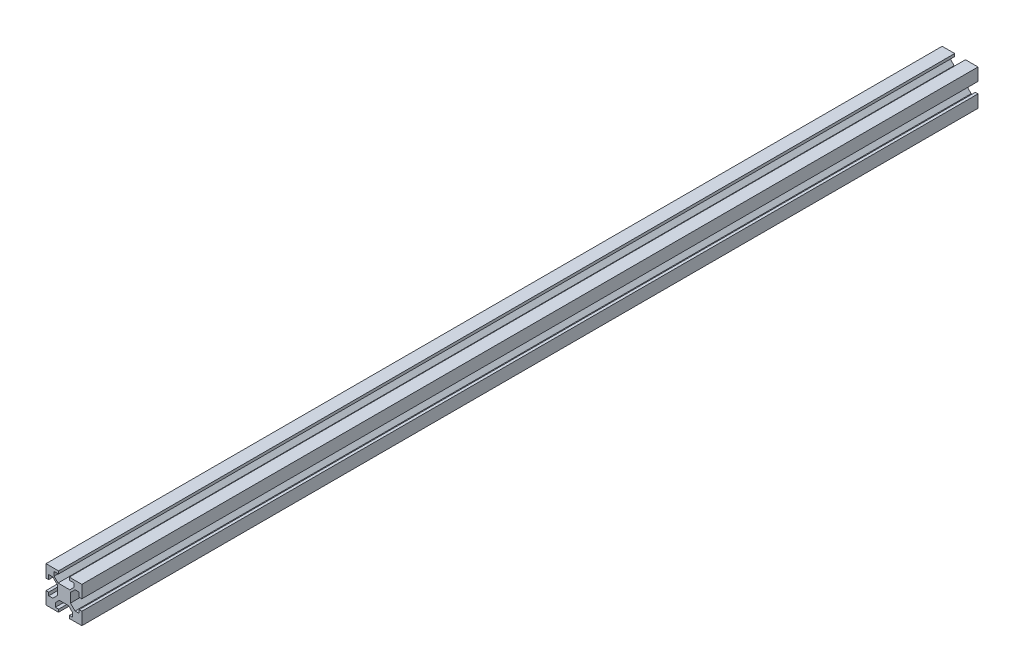
from build123d import *

# Parameters (mm, degrees)
BOSS_EXTRUDE1_DEPTH = 500


with BuildPart() as part:
    # Sketch1 → Boss-Extrude1 (new body)
    with BuildSketch(Plane.XY):
        Polygon((-10, 3), (-10, 10), (-3, 10), (-3, 8.5), (-5.5, 8.5), (-5.5, 6.207106781), (-3.292893219, 4), (3.292893219, 4), (5.5, 6.207106781), (5.5, 8.5), (3, 8.5), (3, 10), (10, 10), (10, 3), (8.5, 3), (8.5, 5.5), (6.207106781, 5.5), (3.645660172, 2.938553391), (3.645660172, -2.231446609), (6.207106781, -4.792893219), (8.5, -4.792893219), (8.5, -3), (10, -3), (10, -10), (3, -10), (3, -8.5), (4.792893219, -8.5), (4.792893219, -6.207106781), (2.585786438, -4), (-2.585786438, -4), (-4.792893219, -6.207106781), (-4.792893219, -8.5), (-3, -8.5), (-3, -10), (-10, -10), (-10, -3), (-8.5, -3), (-8.5, -4.792893219), (-6.207106781, -4.792893219), (-3.645660172, -2.231446609), (-3.645660172, 2.938553391), (-6.207106781, 5.5), (-8.5, 5.5), (-8.5, 3), align=None)
    extrude(amount=-BOSS_EXTRUDE1_DEPTH)


solid = part.part
